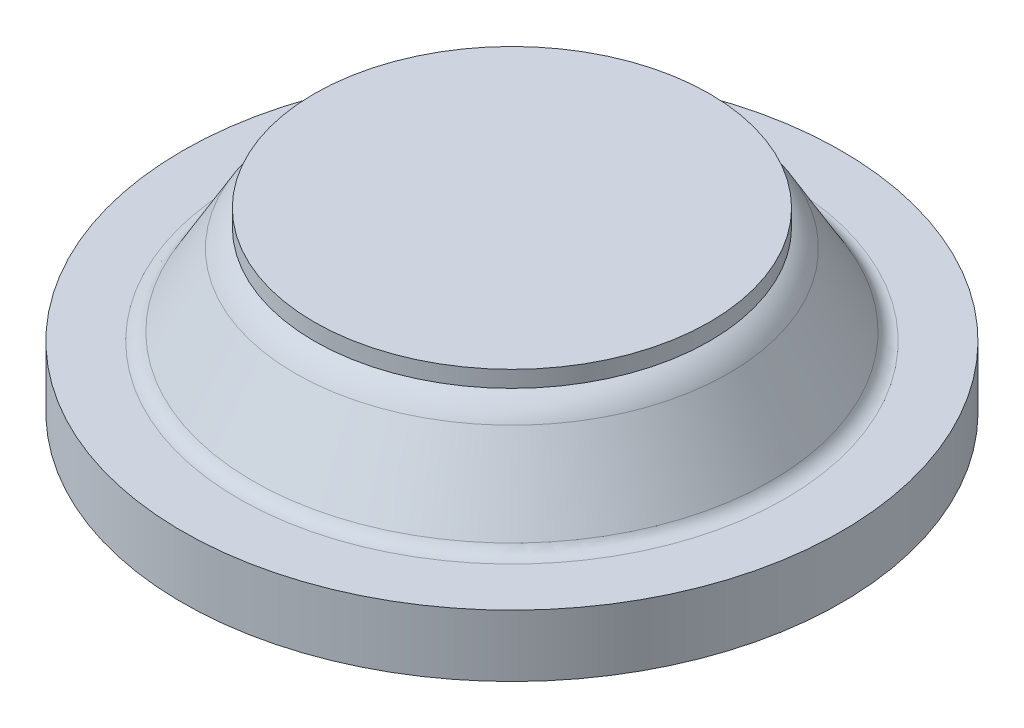
from build123d import *

# Parameters (mm, degrees)
SKETCH3_R           = 30.48
BOSS_EXTRUDE1_DEPTH = 2.54
SKETCH6_R           = 50.8
BOSS_EXTRUDE2_DEPTH = 9.525
FILLET2_R           = 2.54
FILLET1_R           = 7.62


with BuildPart() as part:
    # Sketch1 → Revolve1 (revolve)
    with BuildSketch(Plane.XY, mode=Mode.PRIVATE) as revolve1_sk:
        Polygon((0, 0), (0, -15.24), (40.64, -15.24), (31.75, 0), align=None)
    revolve(revolve1_sk.sketch.rotate(Axis((0, 0, 0), (0, -1, 0)), 180), axis=Axis((0, 0, 0), (0, -1, 0)))

    # Sketch3 → Boss-Extrude1 (add)
    with BuildSketch(Plane(origin=(0, 0, 0), x_dir=(1, 0, 0), z_dir=(0, 1, 0))):
        Circle(SKETCH3_R)
    extrude(amount=BOSS_EXTRUDE1_DEPTH)

    # Sketch6 → Boss-Extrude2 (add)
    with BuildSketch(Plane.XZ.offset(15.24)):
        with Locations(Location((0, 0, 0), (0, 0, 180))):
            Circle(SKETCH6_R)
    extrude(amount=BOSS_EXTRUDE2_DEPTH)

    # Fillet2
    fillet2_edges = [part.edges().sort_by_distance(p)[0] for p in [
        (40.64, -15.24, 0),
    ]]
    fillet(fillet2_edges, radius=FILLET2_R)

    # Fillet1
    # the kernel refuses this fillet: 7.62 mm, written as the material it takes off along each edge
    with BuildSketch(Plane(origin=(0, 0, 0), x_dir=(-1, 0, 0), z_dir=(0, 0, 1))) as fillet1_piece_1:
        with BuildLine():
            CenterArc((26.830262481, 6.689081854), FILLET1_R, 298.618033777, 31.125529059)
            Line((30.48, 0), (30.55299475, -0.133781637))
            ThreePointArc((30.55299475, -0.133781637), (31.115, -0.1524), (31.75, -0.1524))
            Line((31.75, -0.1524), (31.881639904, -0.076789944))
            Line((31.881639904, -0.076789944), (33.543897611, 2.772794695))
            Line((33.543897611, 2.772794695), (33.412257706, 2.849584639))
        make_face()
    revolve(axis=Axis((0, 0, 0), (0, -1, 0)), mode=Mode.SUBTRACT)


solid = part.part
